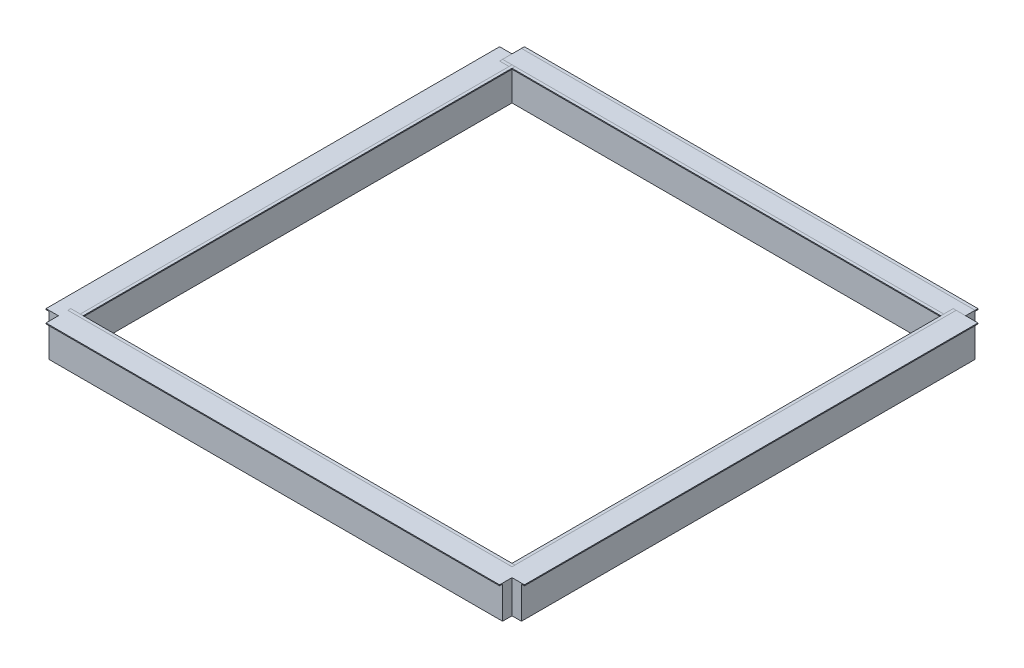
from build123d import *

# Parameters (mm, degrees)
FIXTURE_START       = -44.45
FIXTURE_OUTLINE_W   = 1219.2
FIXTURE_OUTLINE_H   = 50.8
FIXTURE_DEPTH       = 88.9
FIXTURE_2_OUTLINE_W = 50.8
FIXTURE_2_OUTLINE_H = 1219.2
FIXTURE_2_DEPTH     = 88.9
FIXTURE_3_OUTLINE_W = 50.8
FIXTURE_3_OUTLINE_H = 1219.2
FIXTURE_3_DEPTH     = 88.9
FIXTURE_4_OUTLINE_W = 1219.2
FIXTURE_4_OUTLINE_H = 50.8
FIXTURE_4_DEPTH     = 88.9
OUTERFLANGE_START   = 44.45
SKETCH13_W          = 7.9375
SKETCH13_H          = 1219.2
SKETCH13_W_2        = 1219.2
SKETCH13_H_2        = 7.9375
OUTERFLANGE_DEPTH   = 2.54
INNERFLANGE_START   = 44.45
SKETCH14_W          = 7.9375
SKETCH14_H          = 1219.2
INNERFLANGE_DEPTH   = 2.54
SKETCH14_W_2        = 1219.2
SKETCH14_H_2        = 7.9375
INNERFLANGE_2_DEPTH = 2.54
INNERFLANGE_3_DEPTH = 2.54
INNERFLANGE_4_DEPTH = 2.54


with BuildPart() as part:
    # Fixture: read off the stored shape, not the designer's step
    # Fixture outline → Fixture (new body)
    with BuildSketch(Plane(origin=(0, 0, 0), x_dir=(1, 0, 0), z_dir=(0, 1, 0)).offset(FIXTURE_START)):
        with Locations((0, 609.6)):
            Rectangle(FIXTURE_OUTLINE_W, FIXTURE_OUTLINE_H)
    extrude(amount=FIXTURE_DEPTH)


with BuildPart() as body_2:
    # Fixture 2 outline → Fixture 2 (new body)
    with BuildSketch(Plane(origin=(0, 0, 0), x_dir=(1, 0, 0), z_dir=(0, 1, 0)).offset(FIXTURE_START)):
        with Locations((609.6, 0)):
            Rectangle(FIXTURE_2_OUTLINE_W, FIXTURE_2_OUTLINE_H)
    extrude(amount=FIXTURE_2_DEPTH)



with BuildPart() as body_3:
    # Fixture 3 outline → Fixture 3 (new body)
    with BuildSketch(Plane(origin=(0, 0, 0), x_dir=(1, 0, 0), z_dir=(0, 1, 0)).offset(FIXTURE_START)):
        with Locations((-609.6, 0)):
            Rectangle(FIXTURE_3_OUTLINE_W, FIXTURE_3_OUTLINE_H)
    extrude(amount=FIXTURE_3_DEPTH)


with BuildPart() as body_4:
    # Fixture 4 outline → Fixture 4 (new body)
    with BuildSketch(Plane(origin=(0, 0, 0), x_dir=(1, 0, 0), z_dir=(0, 1, 0)).offset(FIXTURE_START)):
        with Locations((0, -609.6)):
            Rectangle(FIXTURE_4_OUTLINE_W, FIXTURE_4_OUTLINE_H)
    extrude(amount=FIXTURE_4_DEPTH)


with BuildPart() as body_2_1:
    add(body_2.part)

    add(body_3.part)  # OuterFlange merges body 3

    add(body_4.part)  # OuterFlange merges body 4
    # Sketch13 → OuterFlange (add)
    with BuildSketch(Plane(origin=(0, 0, 0), x_dir=(1, 0, 0), z_dir=(0, 1, 0)).offset(OUTERFLANGE_START)):
        with Locations((638.96875, 0)):
            Rectangle(SKETCH13_W, SKETCH13_H)
        with Locations((0, -638.96875)):
            Rectangle(SKETCH13_W_2, SKETCH13_H_2)
        with Locations((-638.96875, 0)):
            Rectangle(SKETCH13_W, SKETCH13_H)
        with Locations((0, 638.96875)):
            Rectangle(SKETCH13_W_2, SKETCH13_H_2)
    extrude(amount=-OUTERFLANGE_DEPTH)


with BuildPart() as body_3_2:
    # Sketch14 → InnerFlange (new body)
    with BuildSketch(Plane(origin=(0, 0, 0), x_dir=(1, 0, 0), z_dir=(0, 1, 0)).offset(INNERFLANGE_START)):
        with Locations((580.23125, 0)):
            Rectangle(SKETCH14_W, SKETCH14_H)
    extrude(amount=-INNERFLANGE_DEPTH)


with BuildPart() as body_4_2:
    # Sketch14 → InnerFlange 2 (new body)
    with BuildSketch(Plane(origin=(0, 0, 0), x_dir=(1, 0, 0), z_dir=(0, 1, 0)).offset(INNERFLANGE_START)):
        with Locations((0, -580.23125)):
            Rectangle(SKETCH14_W_2, SKETCH14_H_2)
    extrude(amount=-INNERFLANGE_2_DEPTH)


with BuildPart() as body_5:
    # Sketch14 → InnerFlange 3 (new body)
    with BuildSketch(Plane(origin=(0, 0, 0), x_dir=(1, 0, 0), z_dir=(0, 1, 0)).offset(INNERFLANGE_START)):
        with Locations((-580.23125, 0)):
            Rectangle(SKETCH14_W, SKETCH14_H)
    extrude(amount=-INNERFLANGE_3_DEPTH)


with BuildPart() as body_6:
    # Sketch14 → InnerFlange 4 (new body)
    with BuildSketch(Plane(origin=(0, 0, 0), x_dir=(1, 0, 0), z_dir=(0, 1, 0)).offset(INNERFLANGE_START)):
        with Locations((0, 580.23125)):
            Rectangle(SKETCH14_W_2, SKETCH14_H_2)
    extrude(amount=-INNERFLANGE_4_DEPTH)


solid = Compound([part.part, body_2_1.part, body_3_2.part, body_4_2.part, body_5.part, body_6.part])
